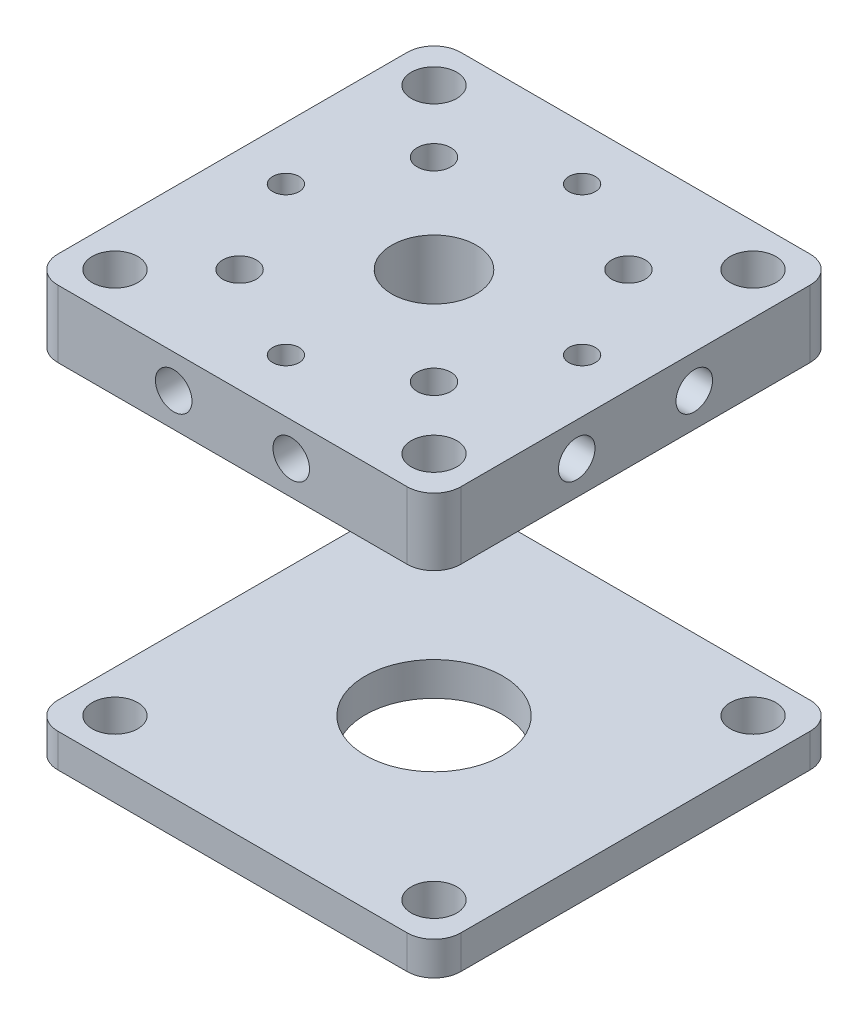
from build123d import *

# Parameters (mm, degrees)
SKETCH1_W           = 38.1
SKETCH1_H           = 38.1
SKETCH1_R           = 1.25
SKETCH1_R_2         = 1.5875
SKETCH1_R_3         = 4
BOSS_EXTRUDE1_DEPTH = 3.175
SKETCH4_R           = 1.7272
CUT_EXTRUDE2_DEPTH  = 9.525
SKETCH7_R           = 2.15265
CUT_EXTRUDE3_DEPTH  = 28.679008291
CIRPATTERN1_COUNT   = 4
SKETCH6_W           = 38.1
SKETCH6_H           = 38.1
SKETCH6_R           = 6.5
SKETCH6_R_2         = 2.15265
BOSS_EXTRUDE2_DEPTH = 3.175
FILLET1_R           = 2.54
FILLET2_R           = 2.54


with BuildPart() as part:
    # Sketch1 → Boss-Extrude1 (new, symmetric)
    with BuildSketch(Plane(origin=(0, 0, 0), x_dir=(1, 0, 0), z_dir=(0, 1, 0))):
        Rectangle(SKETCH1_W, SKETCH1_H)
        with Locations((0, -14)):
            Circle(SKETCH1_R, mode=Mode.SUBTRACT)
        with Locations((-9.192388155, -9.192388155)):
            Circle(SKETCH1_R_2, mode=Mode.SUBTRACT)
        with Locations((9.192388155, -9.192388155)):
            Circle(SKETCH1_R_2, mode=Mode.SUBTRACT)
        with Locations((-14, 0)):
            Circle(SKETCH1_R, mode=Mode.SUBTRACT)
        Circle(SKETCH1_R_3, mode=Mode.SUBTRACT)
        with BuildLine():
            ThreePointArc((-8.954362092, 10.761942182), (-7.988639297, 10.227349477), (-7.604888155, 9.192388155))
            ThreePointArc((-7.604888155, 9.192388155), (-10.396137013, 8.157426834), (-8.954362092, 10.761942182))
        make_face(mode=Mode.SUBTRACT)
        with BuildLine():
            ThreePointArc((1.25, 14), (0.027908743, 12.750311598), (-1.248753763, 13.944196429))
            ThreePointArc((-1.248753763, 13.944196429), (-0.027908743, 15.249688402), (1.25, 14))
        make_face(mode=Mode.SUBTRACT)
        with Locations((9.192388155, 9.192388155)):
            Circle(SKETCH1_R_2, mode=Mode.SUBTRACT)
        with Locations((14, 0)):
            Circle(SKETCH1_R, mode=Mode.SUBTRACT)
    extrude(amount=BOSS_EXTRUDE1_DEPTH, both=True)

    # Sketch4 → Cut-Extrude2 (cut)
    with BuildSketch(Plane.XY.offset(19.05)):
        with Locations((-5.55625, 0)):
            Circle(SKETCH4_R)
        with Locations((5.55625, 0)):
            Circle(SKETCH4_R)
    cut_extrude2 = extrude(amount=-CUT_EXTRUDE2_DEPTH, mode=Mode.SUBTRACT)

    # Sketch7 → Cut-Extrude3 (cut, through all)
    with BuildSketch(Plane.XZ.offset(3.175)):
        with Locations((-15.08125, 15.08125)):
            Circle(SKETCH7_R)
        with Locations((15.08125, 15.08125)):
            Circle(SKETCH7_R)
        with Locations((15.08125, -15.08125)):
            Circle(SKETCH7_R)
        with Locations((-15.08125, -15.08125)):
            Circle(SKETCH7_R)
    extrude(amount=-CUT_EXTRUDE3_DEPTH, mode=Mode.SUBTRACT)

    # CirPattern1: Cut-Extrude2 ×4 about axis
    cirpattern1_axis = Axis((0, 3.175, 0), (0, -1, 0))
    for i in range(1, CIRPATTERN1_COUNT):
        add(cut_extrude2.rotate(cirpattern1_axis, i * 360 / CIRPATTERN1_COUNT), mode=Mode.SUBTRACT)

    # Fillet1
    fillet1_edges = [part.edges().sort_by_distance(p)[0] for p in [
        (-19.05, 0, 19.05),
        (-19.05, 0, -19.05),
        (19.05, 0, -19.05),
        (19.05, 0, 19.05),
    ]]
    fillet(fillet1_edges, radius=FILLET1_R)


with BuildPart() as body_2:
    # Sketch6 → Boss-Extrude2 (new body)
    with BuildSketch(Plane(origin=(0, -33.3502, 0), x_dir=(-1, 0, 0), z_dir=(0, -1, 0))):
        Rectangle(SKETCH6_W, SKETCH6_H)
        Circle(SKETCH6_R, mode=Mode.SUBTRACT)
        with Locations((-15.08125, 15.08125)):
            Circle(SKETCH6_R_2, mode=Mode.SUBTRACT)
        with Locations((15.08125, 15.08125)):
            Circle(SKETCH6_R_2, mode=Mode.SUBTRACT)
        with Locations((15.08125, -15.08125)):
            Circle(SKETCH6_R_2, mode=Mode.SUBTRACT)
        with Locations((-15.08125, -15.08125)):
            Circle(SKETCH6_R_2, mode=Mode.SUBTRACT)
    extrude(amount=BOSS_EXTRUDE2_DEPTH)

    # Fillet2
    fillet2_edges = [body_2.edges().sort_by_distance(p)[0] for p in [
        (-19.05, -34.9377, 19.05),
        (-19.05, -34.9377, -19.05),
        (19.05, -34.9377, -19.05),
        (19.05, -34.9377, 19.05),
    ]]
    fillet(fillet2_edges, radius=FILLET2_R)


solid = Compound([part.part, body_2.part])
